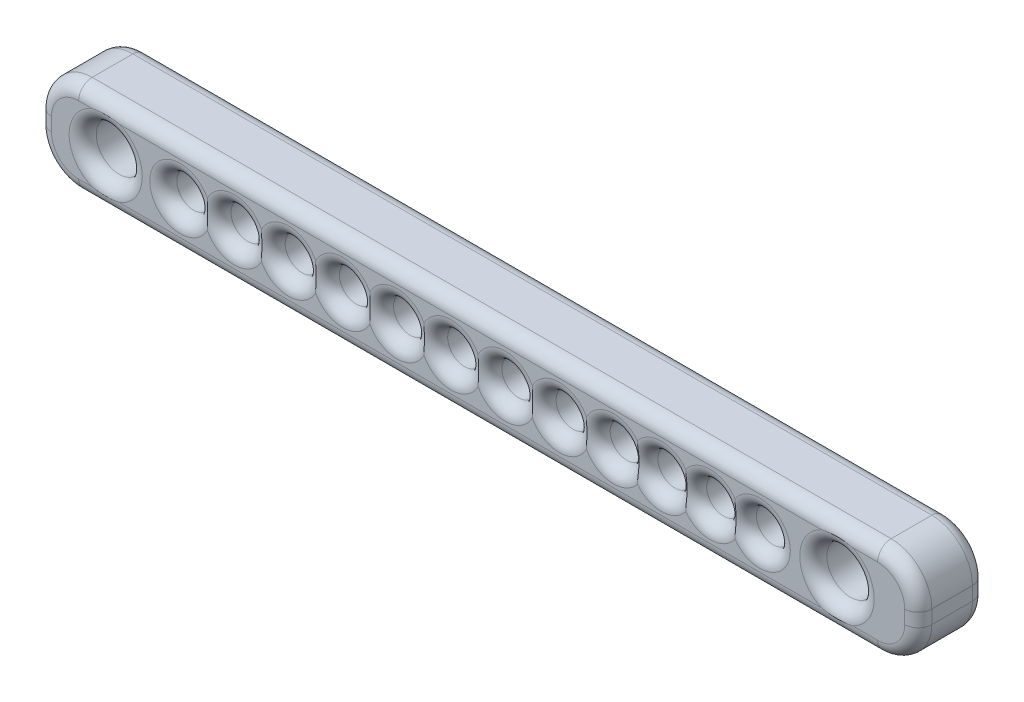
from build123d import *

# Parameters (mm, degrees)
SKETCH_1_W      = 65
SKETCH_1_H      = 7
SKETCH_1_R      = 1.7
SKETCH_1_R_2    = 1.25
SKETCH_1_R_3    = 1.75
EXTRUDE_1_DEPTH = 5
FILLET_1_R      = 3
FILLET_2_R      = 1


with BuildPart() as part:
    # 草圖1 → 填料-伸長1 (new body)
    with BuildSketch(Plane.XY):
        Rectangle(SKETCH_1_W, SKETCH_1_H)
        with Locations((-27.5, 0)):
            Circle(SKETCH_1_R, mode=Mode.SUBTRACT)
        with Locations((-22, 0)):
            Circle(SKETCH_1_R_2, mode=Mode.SUBTRACT)
        with Locations((-18, 0)):
            Circle(SKETCH_1_R_2, mode=Mode.SUBTRACT)
        with Locations((-14, 0)):
            Circle(SKETCH_1_R_2, mode=Mode.SUBTRACT)
        with Locations((-10, 0)):
            Circle(SKETCH_1_R_2, mode=Mode.SUBTRACT)
        with Locations((-6, 0)):
            Circle(SKETCH_1_R_2, mode=Mode.SUBTRACT)
        with Locations((-2, 0)):
            Circle(SKETCH_1_R_2, mode=Mode.SUBTRACT)
        with Locations((2, 0)):
            Circle(SKETCH_1_R_2, mode=Mode.SUBTRACT)
        with Locations((6, 0)):
            Circle(SKETCH_1_R_2, mode=Mode.SUBTRACT)
        with Locations((10, 0)):
            Circle(SKETCH_1_R_2, mode=Mode.SUBTRACT)
        with Locations((26.5, 0)):
            Circle(SKETCH_1_R_3, mode=Mode.SUBTRACT)
        with Locations((20.801616, 0)):
            Circle(SKETCH_1_R_2, mode=Mode.SUBTRACT)
        with Locations((17.127552943, 0)):
            Circle(SKETCH_1_R_2, mode=Mode.SUBTRACT)
        with Locations((13.530032866, 0)):
            Circle(SKETCH_1_R_2, mode=Mode.SUBTRACT)
    extrude(amount=EXTRUDE_1_DEPTH)

    # 圓角1
    fillet_1_edges = [part.edges().sort_by_distance(p)[0] for p in [
        (-32.5, 3.5, 2.5),
        (32.5, 3.5, 2.5),
        (32.5, -3.5, 2.5),
        (-32.5, -3.5, 2.5),
    ]]
    fillet(fillet_1_edges, radius=FILLET_1_R)

    # 圓角2
    # the kernel refuses this fillet: 1 mm, written as the material it takes off along each edge
    with BuildSketch(Plane(origin=(-27.5, 0, 0), x_dir=(1, 0, 0), z_dir=(0, -1, 0))) as fillet_2_piece_1:
        with BuildLine():
            CenterArc((1.7 + FILLET_2_R, FILLET_2_R), FILLET_2_R, 180, 90)
            Line((1.7, FILLET_2_R), (1.7, 0))
            Line((1.7, 0), (1.7 + FILLET_2_R, 0))
        make_face()
    revolve(axis=Axis((-27.5, 0, 0), (0, 0, 1)), mode=Mode.SUBTRACT)
    with BuildSketch(Plane(origin=(-27.5, 0, 5), x_dir=(1, 0, 0), z_dir=(0, -1, 0))) as fillet_2_piece_2:
        with BuildLine():
            CenterArc((1.7 + FILLET_2_R, -FILLET_2_R), FILLET_2_R, 90, 90)
            Line((1.7, -FILLET_2_R), (1.7, 0))
            Line((1.7, 0), (1.7 + FILLET_2_R, 0))
        make_face()
    revolve(axis=Axis((-27.5, 0, 5), (0, 0, 1)), mode=Mode.SUBTRACT)
    with BuildSketch(Plane(origin=(20.801616, 0, 0), x_dir=(1, 0, 0), z_dir=(0, -1, 0))) as fillet_2_piece_3:
        with BuildLine():
            CenterArc((1.25 + FILLET_2_R, FILLET_2_R), FILLET_2_R, 180, 90)
            Line((1.25, FILLET_2_R), (1.25, 0))
            Line((1.25, 0), (1.25 + FILLET_2_R, 0))
        make_face()
    revolve(axis=Axis((20.801616, 0, 0), (0, 0, 1)), mode=Mode.SUBTRACT)
    with BuildSketch(Plane(origin=(20.801616, 0, 5), x_dir=(1, 0, 0), z_dir=(0, -1, 0))) as fillet_2_piece_4:
        with BuildLine():
            CenterArc((1.25 + FILLET_2_R, -FILLET_2_R), FILLET_2_R, 90, 90)
            Line((1.25, -FILLET_2_R), (1.25, 0))
            Line((1.25, 0), (1.25 + FILLET_2_R, 0))
        make_face()
    revolve(axis=Axis((20.801616, 0, 5), (0, 0, 1)), mode=Mode.SUBTRACT)
    with BuildSketch(Plane(origin=(17.127552943, 0, 0), x_dir=(1, 0, 0), z_dir=(0, -1, 0))) as fillet_2_piece_5:
        with BuildLine():
            CenterArc((1.25 + FILLET_2_R, FILLET_2_R), FILLET_2_R, 180, 90)
            Line((1.25, FILLET_2_R), (1.25, 0))
            Line((1.25, 0), (1.25 + FILLET_2_R, 0))
        make_face()
    revolve(axis=Axis((17.127552943, 0, 0), (0, 0, 1)), mode=Mode.SUBTRACT)
    with BuildSketch(Plane(origin=(17.127552943, 0, 5), x_dir=(1, 0, 0), z_dir=(0, -1, 0))) as fillet_2_piece_6:
        with BuildLine():
            CenterArc((1.25 + FILLET_2_R, -FILLET_2_R), FILLET_2_R, 90, 90)
            Line((1.25, -FILLET_2_R), (1.25, 0))
            Line((1.25, 0), (1.25 + FILLET_2_R, 0))
        make_face()
    revolve(axis=Axis((17.127552943, 0, 5), (0, 0, 1)), mode=Mode.SUBTRACT)
    with BuildSketch(Plane(origin=(13.530032866, 0, 0), x_dir=(1, 0, 0), z_dir=(0, -1, 0))) as fillet_2_piece_7:
        with BuildLine():
            CenterArc((1.25 + FILLET_2_R, FILLET_2_R), FILLET_2_R, 180, 90)
            Line((1.25, FILLET_2_R), (1.25, 0))
            Line((1.25, 0), (1.25 + FILLET_2_R, 0))
        make_face()
    revolve(axis=Axis((13.530032866, 0, 0), (0, 0, 1)), mode=Mode.SUBTRACT)
    with BuildSketch(Plane(origin=(13.530032866, 0, 5), x_dir=(1, 0, 0), z_dir=(0, -1, 0))) as fillet_2_piece_8:
        with BuildLine():
            CenterArc((1.25 + FILLET_2_R, -FILLET_2_R), FILLET_2_R, 90, 90)
            Line((1.25, -FILLET_2_R), (1.25, 0))
            Line((1.25, 0), (1.25 + FILLET_2_R, 0))
        make_face()
    revolve(axis=Axis((13.530032866, 0, 5), (0, 0, 1)), mode=Mode.SUBTRACT)
    with BuildSketch(Plane(origin=(-22, 0, 0), x_dir=(1, 0, 0), z_dir=(0, -1, 0))) as fillet_2_piece_9:
        with BuildLine():
            CenterArc((1.25 + FILLET_2_R, FILLET_2_R), FILLET_2_R, 180, 90)
            Line((1.25, FILLET_2_R), (1.25, 0))
            Line((1.25, 0), (1.25 + FILLET_2_R, 0))
        make_face()
    revolve(axis=Axis((-22, 0, 0), (0, 0, 1)), mode=Mode.SUBTRACT)
    with BuildSketch(Plane(origin=(-22, 0, 5), x_dir=(1, 0, 0), z_dir=(0, -1, 0))) as fillet_2_piece_10:
        with BuildLine():
            CenterArc((1.25 + FILLET_2_R, -FILLET_2_R), FILLET_2_R, 90, 90)
            Line((1.25, -FILLET_2_R), (1.25, 0))
            Line((1.25, 0), (1.25 + FILLET_2_R, 0))
        make_face()
    revolve(axis=Axis((-22, 0, 5), (0, 0, 1)), mode=Mode.SUBTRACT)
    with BuildSketch(Plane(origin=(-18, 0, 0), x_dir=(1, 0, 0), z_dir=(0, -1, 0))) as fillet_2_piece_11:
        with BuildLine():
            CenterArc((1.25 + FILLET_2_R, FILLET_2_R), FILLET_2_R, 180, 90)
            Line((1.25, FILLET_2_R), (1.25, 0))
            Line((1.25, 0), (1.25 + FILLET_2_R, 0))
        make_face()
    revolve(axis=Axis((-18, 0, 0), (0, 0, 1)), mode=Mode.SUBTRACT)
    with BuildSketch(Plane(origin=(-18, 0, 5), x_dir=(1, 0, 0), z_dir=(0, -1, 0))) as fillet_2_piece_12:
        with BuildLine():
            CenterArc((1.25 + FILLET_2_R, -FILLET_2_R), FILLET_2_R, 90, 90)
            Line((1.25, -FILLET_2_R), (1.25, 0))
            Line((1.25, 0), (1.25 + FILLET_2_R, 0))
        make_face()
    revolve(axis=Axis((-18, 0, 5), (0, 0, 1)), mode=Mode.SUBTRACT)
    with BuildSketch(Plane(origin=(-14, 0, 0), x_dir=(1, 0, 0), z_dir=(0, -1, 0))) as fillet_2_piece_13:
        with BuildLine():
            CenterArc((1.25 + FILLET_2_R, FILLET_2_R), FILLET_2_R, 180, 90)
            Line((1.25, FILLET_2_R), (1.25, 0))
            Line((1.25, 0), (1.25 + FILLET_2_R, 0))
        make_face()
    revolve(axis=Axis((-14, 0, 0), (0, 0, 1)), mode=Mode.SUBTRACT)
    with BuildSketch(Plane(origin=(-14, 0, 5), x_dir=(1, 0, 0), z_dir=(0, -1, 0))) as fillet_2_piece_14:
        with BuildLine():
            CenterArc((1.25 + FILLET_2_R, -FILLET_2_R), FILLET_2_R, 90, 90)
            Line((1.25, -FILLET_2_R), (1.25, 0))
            Line((1.25, 0), (1.25 + FILLET_2_R, 0))
        make_face()
    revolve(axis=Axis((-14, 0, 5), (0, 0, 1)), mode=Mode.SUBTRACT)
    with BuildSketch(Plane(origin=(-10, 0, 0), x_dir=(1, 0, 0), z_dir=(0, -1, 0))) as fillet_2_piece_15:
        with BuildLine():
            CenterArc((1.25 + FILLET_2_R, FILLET_2_R), FILLET_2_R, 180, 90)
            Line((1.25, FILLET_2_R), (1.25, 0))
            Line((1.25, 0), (1.25 + FILLET_2_R, 0))
        make_face()
    revolve(axis=Axis((-10, 0, 0), (0, 0, 1)), mode=Mode.SUBTRACT)
    with BuildSketch(Plane(origin=(-10, 0, 5), x_dir=(1, 0, 0), z_dir=(0, -1, 0))) as fillet_2_piece_16:
        with BuildLine():
            CenterArc((1.25 + FILLET_2_R, -FILLET_2_R), FILLET_2_R, 90, 90)
            Line((1.25, -FILLET_2_R), (1.25, 0))
            Line((1.25, 0), (1.25 + FILLET_2_R, 0))
        make_face()
    revolve(axis=Axis((-10, 0, 5), (0, 0, 1)), mode=Mode.SUBTRACT)
    with BuildSketch(Plane(origin=(-6, 0, 0), x_dir=(1, 0, 0), z_dir=(0, -1, 0))) as fillet_2_piece_17:
        with BuildLine():
            CenterArc((1.25 + FILLET_2_R, FILLET_2_R), FILLET_2_R, 180, 90)
            Line((1.25, FILLET_2_R), (1.25, 0))
            Line((1.25, 0), (1.25 + FILLET_2_R, 0))
        make_face()
    revolve(axis=Axis((-6, 0, 0), (0, 0, 1)), mode=Mode.SUBTRACT)
    with BuildSketch(Plane(origin=(-6, 0, 5), x_dir=(1, 0, 0), z_dir=(0, -1, 0))) as fillet_2_piece_18:
        with BuildLine():
            CenterArc((1.25 + FILLET_2_R, -FILLET_2_R), FILLET_2_R, 90, 90)
            Line((1.25, -FILLET_2_R), (1.25, 0))
            Line((1.25, 0), (1.25 + FILLET_2_R, 0))
        make_face()
    revolve(axis=Axis((-6, 0, 5), (0, 0, 1)), mode=Mode.SUBTRACT)
    with BuildSketch(Plane(origin=(-2, 0, 0), x_dir=(1, 0, 0), z_dir=(0, -1, 0))) as fillet_2_piece_19:
        with BuildLine():
            CenterArc((1.25 + FILLET_2_R, FILLET_2_R), FILLET_2_R, 180, 90)
            Line((1.25, FILLET_2_R), (1.25, 0))
            Line((1.25, 0), (1.25 + FILLET_2_R, 0))
        make_face()
    revolve(axis=Axis((-2, 0, 0), (0, 0, 1)), mode=Mode.SUBTRACT)
    with BuildSketch(Plane(origin=(-2, 0, 5), x_dir=(1, 0, 0), z_dir=(0, -1, 0))) as fillet_2_piece_20:
        with BuildLine():
            CenterArc((1.25 + FILLET_2_R, -FILLET_2_R), FILLET_2_R, 90, 90)
            Line((1.25, -FILLET_2_R), (1.25, 0))
            Line((1.25, 0), (1.25 + FILLET_2_R, 0))
        make_face()
    revolve(axis=Axis((-2, 0, 5), (0, 0, 1)), mode=Mode.SUBTRACT)
    with BuildSketch(Plane(origin=(2, 0, 0), x_dir=(1, 0, 0), z_dir=(0, -1, 0))) as fillet_2_piece_21:
        with BuildLine():
            CenterArc((1.25 + FILLET_2_R, FILLET_2_R), FILLET_2_R, 180, 90)
            Line((1.25, FILLET_2_R), (1.25, 0))
            Line((1.25, 0), (1.25 + FILLET_2_R, 0))
        make_face()
    revolve(axis=Axis((2, 0, 0), (0, 0, 1)), mode=Mode.SUBTRACT)
    with BuildSketch(Plane(origin=(2, 0, 5), x_dir=(1, 0, 0), z_dir=(0, -1, 0))) as fillet_2_piece_22:
        with BuildLine():
            CenterArc((1.25 + FILLET_2_R, -FILLET_2_R), FILLET_2_R, 90, 90)
            Line((1.25, -FILLET_2_R), (1.25, 0))
            Line((1.25, 0), (1.25 + FILLET_2_R, 0))
        make_face()
    revolve(axis=Axis((2, 0, 5), (0, 0, 1)), mode=Mode.SUBTRACT)
    with BuildSketch(Plane(origin=(6, 0, 0), x_dir=(1, 0, 0), z_dir=(0, -1, 0))) as fillet_2_piece_23:
        with BuildLine():
            CenterArc((1.25 + FILLET_2_R, FILLET_2_R), FILLET_2_R, 180, 90)
            Line((1.25, FILLET_2_R), (1.25, 0))
            Line((1.25, 0), (1.25 + FILLET_2_R, 0))
        make_face()
    revolve(axis=Axis((6, 0, 0), (0, 0, 1)), mode=Mode.SUBTRACT)
    with BuildSketch(Plane(origin=(6, 0, 5), x_dir=(1, 0, 0), z_dir=(0, -1, 0))) as fillet_2_piece_24:
        with BuildLine():
            CenterArc((1.25 + FILLET_2_R, -FILLET_2_R), FILLET_2_R, 90, 90)
            Line((1.25, -FILLET_2_R), (1.25, 0))
            Line((1.25, 0), (1.25 + FILLET_2_R, 0))
        make_face()
    revolve(axis=Axis((6, 0, 5), (0, 0, 1)), mode=Mode.SUBTRACT)
    with BuildSketch(Plane(origin=(10, 0, 0), x_dir=(1, 0, 0), z_dir=(0, -1, 0))) as fillet_2_piece_25:
        with BuildLine():
            CenterArc((1.25 + FILLET_2_R, FILLET_2_R), FILLET_2_R, 180, 90)
            Line((1.25, FILLET_2_R), (1.25, 0))
            Line((1.25, 0), (1.25 + FILLET_2_R, 0))
        make_face()
    revolve(axis=Axis((10, 0, 0), (0, 0, 1)), mode=Mode.SUBTRACT)
    with BuildSketch(Plane(origin=(10, 0, 5), x_dir=(1, 0, 0), z_dir=(0, -1, 0))) as fillet_2_piece_26:
        with BuildLine():
            CenterArc((1.25 + FILLET_2_R, -FILLET_2_R), FILLET_2_R, 90, 90)
            Line((1.25, -FILLET_2_R), (1.25, 0))
            Line((1.25, 0), (1.25 + FILLET_2_R, 0))
        make_face()
    revolve(axis=Axis((10, 0, 5), (0, 0, 1)), mode=Mode.SUBTRACT)
    with BuildSketch(Plane(origin=(26.5, 0, 0), x_dir=(1, 0, 0), z_dir=(0, -1, 0))) as fillet_2_piece_27:
        with BuildLine():
            CenterArc((1.75 + FILLET_2_R, FILLET_2_R), FILLET_2_R, 180, 90)
            Line((1.75, FILLET_2_R), (1.75, 0))
            Line((1.75, 0), (1.75 + FILLET_2_R, 0))
        make_face()
    revolve(axis=Axis((26.5, 0, 0), (0, 0, 1)), mode=Mode.SUBTRACT)
    with BuildSketch(Plane(origin=(26.5, 0, 5), x_dir=(1, 0, 0), z_dir=(0, -1, 0))) as fillet_2_piece_28:
        with BuildLine():
            CenterArc((1.75 + FILLET_2_R, -FILLET_2_R), FILLET_2_R, 90, 90)
            Line((1.75, -FILLET_2_R), (1.75, 0))
            Line((1.75, 0), (1.75 + FILLET_2_R, 0))
        make_face()
    revolve(axis=Axis((26.5, 0, 5), (0, 0, 1)), mode=Mode.SUBTRACT)
    with BuildSketch(Plane(origin=(29.5, -3.5, 0), x_dir=(0, 0, 1), z_dir=(-1, 0, 0)), Plane(origin=(-29.5, 3.5, 5), x_dir=(0, -1, 0), z_dir=(1, 0, 0))) as fillet_2_piece_29:
        with BuildLine():
            CenterArc((FILLET_2_R, FILLET_2_R), FILLET_2_R, 180, 90)
            Line((0, FILLET_2_R), (0, 0))
            Line((0, 0), (FILLET_2_R, 0))
        make_face()
    extrude(amount=59, mode=Mode.SUBTRACT)
    with BuildSketch(Plane(origin=(29.5, -3.5, 5), x_dir=(0, 0, -1), z_dir=(-1, 0, 0)), Plane(origin=(-29.5, 3.5, 0), x_dir=(0, -1, 0), z_dir=(1, 0, 0))) as fillet_2_piece_30:
        with BuildLine():
            CenterArc((FILLET_2_R, -FILLET_2_R), FILLET_2_R, 90, 90)
            Line((0, -FILLET_2_R), (0, 0))
            Line((0, 0), (FILLET_2_R, 0))
        make_face()
    extrude(amount=59, mode=Mode.SUBTRACT)
    with BuildSketch(Plane(origin=(-32.5, -0.5, 0), x_dir=(1, 0, 0), z_dir=(0, 1, 0)), Plane(origin=(32.5, 0.5, 0), x_dir=(-1, 0, 0), z_dir=(0, -1, 0))) as fillet_2_piece_31:
        with BuildLine():
            CenterArc((FILLET_2_R, -FILLET_2_R), FILLET_2_R, 90, 90)
            Line((0, -FILLET_2_R), (0, 0))
            Line((0, 0), (FILLET_2_R, 0))
        make_face()
    extrude(amount=1, mode=Mode.SUBTRACT)
    with BuildSketch(Plane(origin=(29.5, 0.5, 0), x_dir=(0, 1, 0), z_dir=(-1, 0, 0))) as fillet_2_piece_32:
        with BuildLine():
            CenterArc((3 - FILLET_2_R, -FILLET_2_R), FILLET_2_R, 0, 90)
            Line((3, -FILLET_2_R), (3, 0))
            Line((3, 0), (3 - FILLET_2_R, 0))
        make_face()
    revolve(axis=Axis((29.5, 0.5, 0), (0, 0, -1)), revolution_arc=90, mode=Mode.SUBTRACT)
    with BuildSketch(Plane(origin=(29.5, -0.5, 0), x_dir=(0, -1, 0), z_dir=(-1, 0, 0))) as fillet_2_piece_33:
        with BuildLine():
            CenterArc((3 - FILLET_2_R, FILLET_2_R), FILLET_2_R, 270, 90)
            Line((3, FILLET_2_R), (3, 0))
            Line((3, 0), (3 - FILLET_2_R, 0))
        make_face()
    revolve(axis=Axis((29.5, -0.5, 0), (0, 0, 1)), revolution_arc=90, mode=Mode.SUBTRACT)
    with BuildSketch(Plane(origin=(-29.5, 0.5, 0), x_dir=(-1, 0, 0), z_dir=(0, -1, 0))) as fillet_2_piece_34:
        with BuildLine():
            CenterArc((3 - FILLET_2_R, -FILLET_2_R), FILLET_2_R, 0, 90)
            Line((3, -FILLET_2_R), (3, 0))
            Line((3, 0), (3 - FILLET_2_R, 0))
        make_face()
    revolve(axis=Axis((-29.5, 0.5, 0), (0, 0, -1)), revolution_arc=90, mode=Mode.SUBTRACT)
    with BuildSketch(Plane(origin=(-29.5, -0.5, 0), x_dir=(0, -1, 0), z_dir=(1, 0, 0))) as fillet_2_piece_35:
        with BuildLine():
            CenterArc((3 - FILLET_2_R, -FILLET_2_R), FILLET_2_R, 0, 90)
            Line((3, -FILLET_2_R), (3, 0))
            Line((3, 0), (3 - FILLET_2_R, 0))
        make_face()
    revolve(axis=Axis((-29.5, -0.5, 0), (0, 0, -1)), revolution_arc=90, mode=Mode.SUBTRACT)
    with BuildSketch(Plane(origin=(-32.5, -0.5, 5), x_dir=(1, 0, 0), z_dir=(0, 1, 0)), Plane(origin=(32.5, 0.5, 5), x_dir=(-1, 0, 0), z_dir=(0, -1, 0))) as fillet_2_piece_36:
        with BuildLine():
            CenterArc((FILLET_2_R, FILLET_2_R), FILLET_2_R, 180, 90)
            Line((0, FILLET_2_R), (0, 0))
            Line((0, 0), (FILLET_2_R, 0))
        make_face()
    extrude(amount=1, mode=Mode.SUBTRACT)
    with BuildSketch(Plane(origin=(29.5, 0.5, 5), x_dir=(0, 1, 0), z_dir=(-1, 0, 0))) as fillet_2_piece_37:
        with BuildLine():
            CenterArc((3 - FILLET_2_R, FILLET_2_R), FILLET_2_R, 270, 90)
            Line((3, FILLET_2_R), (3, 0))
            Line((3, 0), (3 - FILLET_2_R, 0))
        make_face()
    revolve(axis=Axis((29.5, 0.5, 5), (0, 0, -1)), revolution_arc=90, mode=Mode.SUBTRACT)
    with BuildSketch(Plane(origin=(29.5, -0.5, 5), x_dir=(0, -1, 0), z_dir=(-1, 0, 0))) as fillet_2_piece_38:
        with BuildLine():
            CenterArc((3 - FILLET_2_R, -FILLET_2_R), FILLET_2_R, 0, 90)
            Line((3 - FILLET_2_R, 0), (3, 0))
            Line((3, 0), (3, -FILLET_2_R))
        make_face()
    revolve(axis=Axis((29.5, -0.5, 5), (0, 0, 1)), revolution_arc=90, mode=Mode.SUBTRACT)
    with BuildSketch(Plane(origin=(-29.5, 0.5, 5), x_dir=(-1, 0, 0), z_dir=(0, -1, 0))) as fillet_2_piece_39:
        with BuildLine():
            CenterArc((3 - FILLET_2_R, FILLET_2_R), FILLET_2_R, 270, 90)
            Line((3, FILLET_2_R), (3, 0))
            Line((3, 0), (3 - FILLET_2_R, 0))
        make_face()
    revolve(axis=Axis((-29.5, 0.5, 5), (0, 0, -1)), revolution_arc=90, mode=Mode.SUBTRACT)
    with BuildSketch(Plane(origin=(-29.5, -0.5, 5), x_dir=(0, -1, 0), z_dir=(1, 0, 0))) as fillet_2_piece_40:
        with BuildLine():
            CenterArc((3 - FILLET_2_R, FILLET_2_R), FILLET_2_R, 270, 90)
            Line((3 - FILLET_2_R, 0), (3, 0))
            Line((3, 0), (3, FILLET_2_R))
        make_face()
    revolve(axis=Axis((-29.5, -0.5, 5), (0, 0, -1)), revolution_arc=90, mode=Mode.SUBTRACT)


solid = part.part
